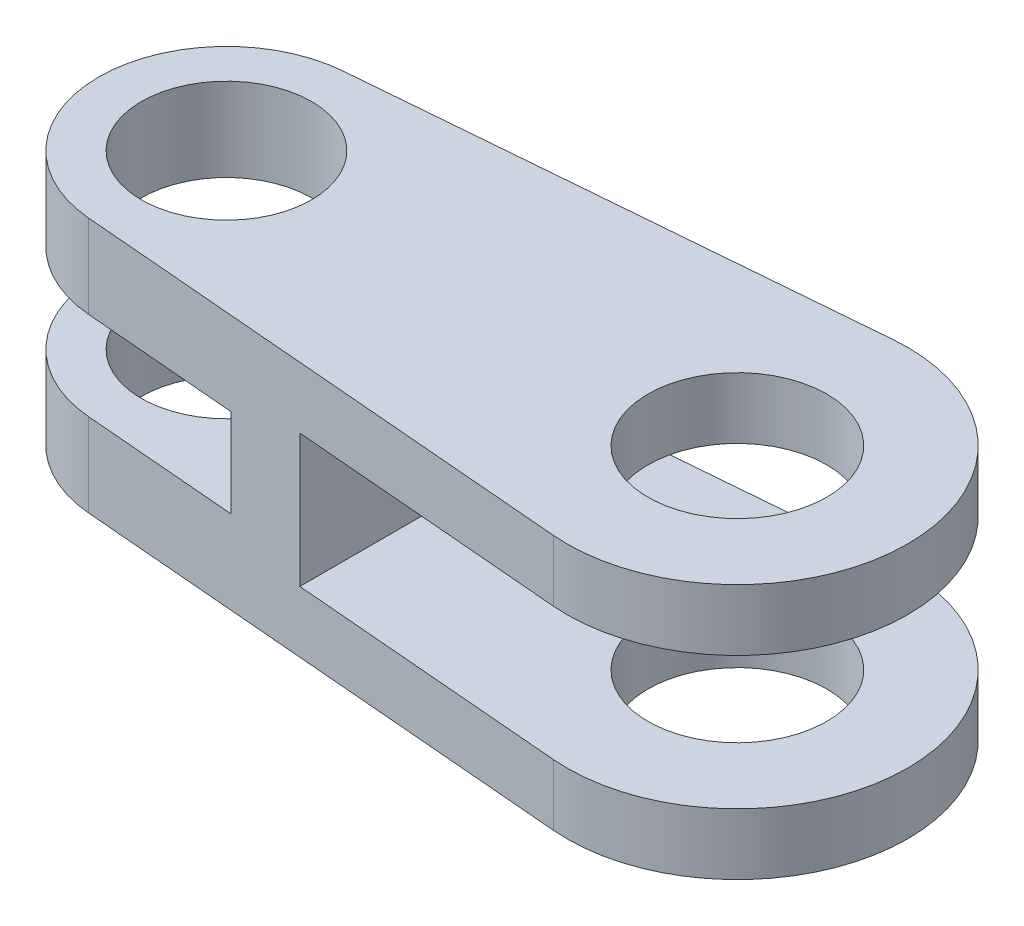
from build123d import *

# Parameters (mm, degrees)
SKETCH1_R           = 6.35
SKETCH1_R_2         = 6.6675
BOSS_EXTRUDE1_DEPTH = 9.525
SKETCH2_W           = 21.59
SKETCH2_H           = 20.921938848
CUT_EXTRUDE1_DEPTH  = 3.302
CUT_EXTRUDE2_DEPTH  = 4.953


with BuildPart() as part:
    # Sketch1 → Boss-Extrude1 (new, symmetric)
    with BuildSketch(Plane(origin=(0, 0, 0), x_dir=(1, 0, 0), z_dir=(0, 1, 0))):
        with BuildLine():
            Line((-0.79375, 9.491869465), (37.041666667, 12.655825953))
            ThreePointArc((37.041666667, 12.655825953), (50.8, 0), (37.041666667, -12.655825953))
            Line((37.041666667, -12.655825953), (-0.79375, -9.491869465))
            ThreePointArc((-0.79375, -9.491869465), (-9.525, 0), (-0.79375, 9.491869465))
        make_face()
        Circle(SKETCH1_R, mode=Mode.SUBTRACT)
        with Locations((38.1, 0)):
            Circle(SKETCH1_R_2, mode=Mode.SUBTRACT)
    extrude(amount=BOSS_EXTRUDE1_DEPTH, both=True)

    # Sketch2 → Cut-Extrude1 (cut, symmetric)
    with BuildSketch(Plane(origin=(0, 0, 0), x_dir=(1, 0, 0), z_dir=(0, 1, 0))):
        Rectangle(SKETCH2_W, SKETCH2_H)
    extrude(amount=CUT_EXTRUDE1_DEPTH, both=True, mode=Mode.SUBTRACT)

    # Sketch3 → Cut-Extrude2 (cut, symmetric)
    with BuildSketch(Plane(origin=(0, 0, 0), x_dir=(1, 0, 0), z_dir=(0, 1, 0))):
        with BuildLine():
            Line((37.041666667, 12.655825953), (16.4, 10.929683071))
            Line((16.4, 10.929683071), (16.4, -10.929683071))
            Line((16.4, -10.929683071), (37.041666667, -12.655825953))
            ThreePointArc((37.041666667, -12.655825953), (50.8, 0), (37.041666667, 12.655825953))
        make_face()
    extrude(amount=CUT_EXTRUDE2_DEPTH, both=True, mode=Mode.SUBTRACT)


solid = part.part
